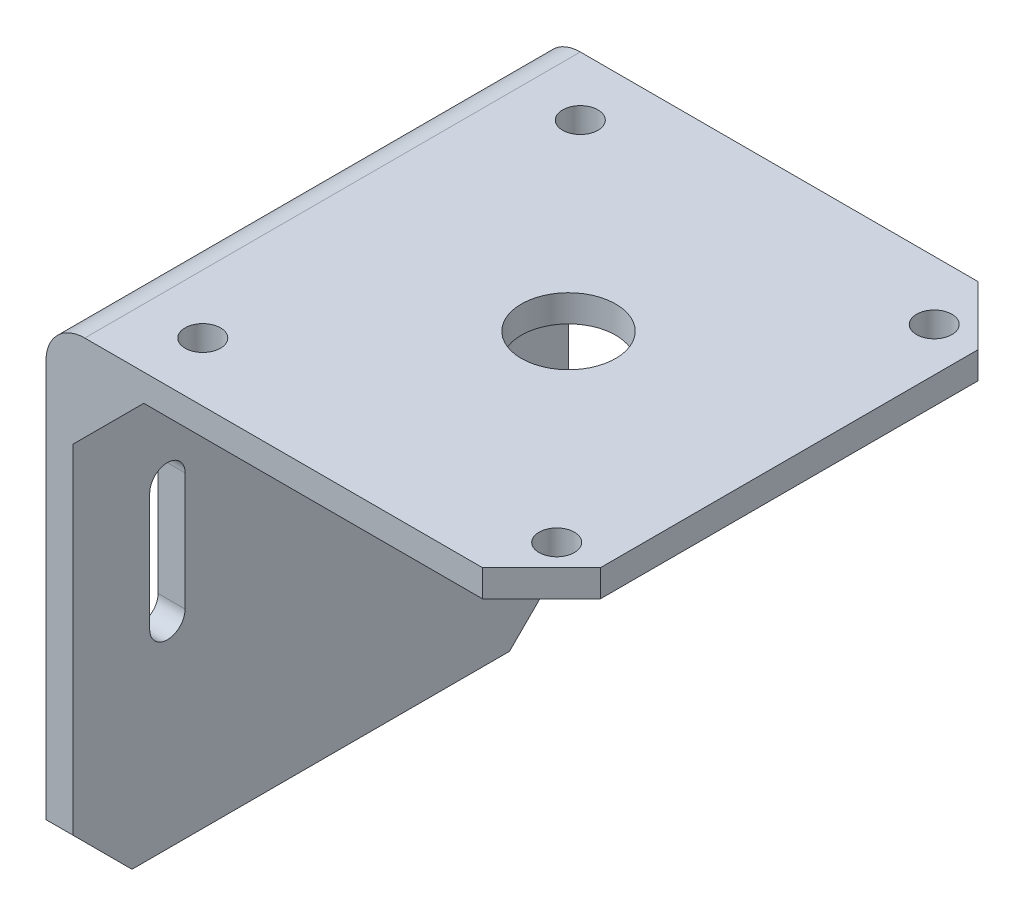
from build123d import *

# Parameters (mm, degrees)
BRIDA_BASE1_DEPTH       = 42
CHAFL_N1_SIZE           = 5
CORTAR_EXTRUIR1_REACH   = 74.746
CROQUIS6_R              = 1.5
CROQUIS6_R_2            = 4
CORTAR_EXTRUIR2_REACH   = 73.448
SALIENTE_EXTRUIR1_START = -2
SALIENTE_EXTRUIR1_DEPTH = 2


# Sheet-metal steps are written as plain solids
with BuildPart() as part:
    # Croquis1 → Brida base1 (new body)
    with BuildSketch(Plane.XY):
        with BuildLine():
            Line((0, 0), (0, 38.71))
            ThreePointArc((0, 38.71), (0.96361869, 41.03638131), (3.29, 42))
            Line((3.29, 42), (42, 42))
            Line((42, 42), (42, 39.71))
            Line((42, 39.71), (3.29, 39.71))
            ThreePointArc((3.29, 39.71), (2.582893219, 39.417106781), (2.29, 38.71))
            Line((2.29, 38.71), (2.29, 0))
            Line((2.29, 0), (0, 0))
        make_face()
    extrude(amount=BRIDA_BASE1_DEPTH)

    # Chaflán1
    chafl_n1_edges = [part.edges().sort_by_distance(p)[0] for p in [
        (1.145, 0, 42),
        (1.145, 0, 0),
        (42, 40.855, 42),
        (42, 40.855, 0),
    ]]
    chamfer(chafl_n1_edges, length=CHAFL_N1_SIZE)

    # Croquis6 → Cortar-Extruir1 (cut, up to next)
    with BuildSketch(Plane(origin=(0, 42, 0), x_dir=(1, 0, 0), z_dir=(0, 1, 0)), mode=Mode.PRIVATE) as cortar_extruir1_sk1:
        with Locations(Location((8.29, -5, 0), (0, 0, 270))):
            Circle(CROQUIS6_R)
    cortar_extruir1_tool1 = extrude(cortar_extruir1_sk1.sketch, amount=-CORTAR_EXTRUIR1_REACH, mode=Mode.PRIVATE) & part.part
    # Croquis6 → Cortar-Extruir1 (cut, up to next)
    with BuildSketch(Plane(origin=(0, 42, 0), x_dir=(1, 0, 0), z_dir=(0, 1, 0)), mode=Mode.PRIVATE) as cortar_extruir1_sk2:
        with Locations(Location((38.29, -5, 0), (0, 0, 270))):
            Circle(CROQUIS6_R)
    cortar_extruir1_tool2 = extrude(cortar_extruir1_sk2.sketch, amount=-CORTAR_EXTRUIR1_REACH, mode=Mode.PRIVATE) & part.part
    # Croquis6 → Cortar-Extruir1 (cut, up to next)
    with BuildSketch(Plane(origin=(0, 42, 0), x_dir=(1, 0, 0), z_dir=(0, 1, 0)), mode=Mode.PRIVATE) as cortar_extruir1_sk3:
        with Locations(Location((38.29, -37, 0), (0, 0, 270))):
            Circle(CROQUIS6_R)
    cortar_extruir1_tool3 = extrude(cortar_extruir1_sk3.sketch, amount=-CORTAR_EXTRUIR1_REACH, mode=Mode.PRIVATE) & part.part
    # Croquis6 → Cortar-Extruir1 (cut, up to next)
    with BuildSketch(Plane(origin=(0, 42, 0), x_dir=(1, 0, 0), z_dir=(0, 1, 0)), mode=Mode.PRIVATE) as cortar_extruir1_sk4:
        with Locations(Location((8.29, -37, 0), (0, 0, 270))):
            Circle(CROQUIS6_R)
    cortar_extruir1_tool4 = extrude(cortar_extruir1_sk4.sketch, amount=-CORTAR_EXTRUIR1_REACH, mode=Mode.PRIVATE) & part.part
    # Croquis6 → Cortar-Extruir1 (cut, up to next)
    with BuildSketch(Plane(origin=(0, 42, 0), x_dir=(1, 0, 0), z_dir=(0, 1, 0)), mode=Mode.PRIVATE) as cortar_extruir1_sk5:
        with Locations(Location((23.29, -21, 0), (0, 0, 270))):
            Circle(CROQUIS6_R_2)
    cortar_extruir1_tool5 = extrude(cortar_extruir1_sk5.sketch, amount=-CORTAR_EXTRUIR1_REACH, mode=Mode.PRIVATE) & part.part
    add(cortar_extruir1_tool1.solids().sort_by_distance((8.29, 42, 5))[0], mode=Mode.SUBTRACT)
    add(cortar_extruir1_tool2.solids().sort_by_distance((38.29, 42, 5))[0], mode=Mode.SUBTRACT)
    add(cortar_extruir1_tool3.solids().sort_by_distance((38.29, 42, 37))[0], mode=Mode.SUBTRACT)
    add(cortar_extruir1_tool4.solids().sort_by_distance((8.29, 42, 37))[0], mode=Mode.SUBTRACT)
    add(cortar_extruir1_tool5.solids().sort_by_distance((23.29, 42, 21))[0], mode=Mode.SUBTRACT)

    # Croquis7 → Cortar-Extruir2 (cut, up to next)
    with BuildSketch(Plane(origin=(2.29, 0, 0), x_dir=(0, 0, -1), z_dir=(1, 0, 0)), mode=Mode.PRIVATE) as cortar_extruir2_sk1:
        with BuildLine():
            Line((-35.5, 16.855), (-35.5, 26.855))
            ThreePointArc((-35.5, 26.855), (-34, 28.355), (-32.5, 26.855))
            Line((-32.5, 26.855), (-32.5, 16.855))
            ThreePointArc((-32.5, 16.855), (-34, 15.355), (-35.5, 16.855))
        make_face()
    cortar_extruir2_tool1 = extrude(cortar_extruir2_sk1.sketch, amount=-CORTAR_EXTRUIR2_REACH, mode=Mode.PRIVATE) & part.part
    # Croquis7 → Cortar-Extruir2 (cut, up to next)
    with BuildSketch(Plane(origin=(2.29, 0, 0), x_dir=(0, 0, -1), z_dir=(1, 0, 0)), mode=Mode.PRIVATE) as cortar_extruir2_sk2:
        with BuildLine():
            Line((-6.5, 16.855), (-6.5, 26.855))
            ThreePointArc((-6.5, 26.855), (-8, 28.355), (-9.5, 26.855))
            Line((-9.5, 26.855), (-9.5, 16.855))
            ThreePointArc((-9.5, 16.855), (-8, 15.355), (-6.5, 16.855))
        make_face()
    cortar_extruir2_tool2 = extrude(cortar_extruir2_sk2.sketch, amount=-CORTAR_EXTRUIR2_REACH, mode=Mode.PRIVATE) & part.part
    add(cortar_extruir2_tool1.solids().sort_by_distance((2.29, 21.855, 34))[0], mode=Mode.SUBTRACT)
    add(cortar_extruir2_tool2.solids().sort_by_distance((2.29, 21.855, 8))[0], mode=Mode.SUBTRACT)

    # Croquis9 → Saliente-Extruir1 (add)
    with BuildSketch(Plane.XY.offset(42).offset(SALIENTE_EXTRUIR1_START)):
        with BuildLine():
            Line((2.29, 38.71), (2.29, 33.71))
            Line((2.29, 33.71), (8.29, 39.71))
            Line((8.29, 39.71), (3.29, 39.71))
            ThreePointArc((3.29, 39.71), (2.582893219, 39.417106781), (2.29, 38.71))
        make_face()
    saliente_extruir1 = extrude(amount=SALIENTE_EXTRUIR1_DEPTH)

    # Simetría1: Saliente-Extruir1 across plane
    add(saliente_extruir1.mirror(Plane.XY.offset(21)))


solid = part.part
